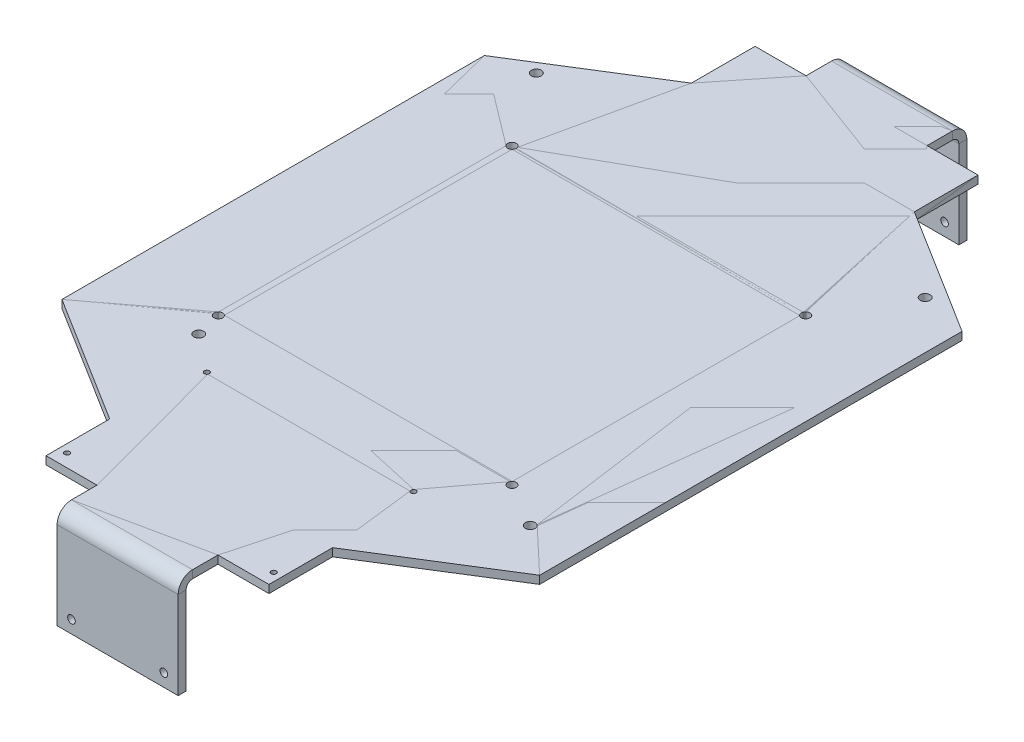
from build123d import *

# Parameters (mm, degrees)
BOSS_EXTRUDE1_DEPTH     = 3.175
CONVERT_SOLID1_DEPTH    = 3.175
EDGE_FLANGE3_DEPTH      = 48.26
EDGE_FLANGE3_BEND_DEPTH = 48.26
SKETCH23_R              = 1.9685000000000155
SKETCH23_R_2            = 1.968500000000002
CUT_EXTRUDE4_DEPTH      = 5.08
SKETCH24_R              = 1.0032999999999983
SKETCH24_R_2            = 1.0032999999999943
CUT_EXTRUDE5_DEPTH      = 188.63312250256496
SKETCH30_R              = 1.524000000000002
CUT_EXTRUDE6_DEPTH      = 3.175
SKETCH27_R              = 1.524000000000002
CUT_EXTRUDE7_DEPTH      = 3.175


# Read off the part's stored shape, not the designer's step: Convert-Solid1
# Sheet-metal steps are written as plain solids
with BuildPart() as part:
    # Sketch2 → Boss-Extrude1 (new body)
    with BuildSketch(Plane(origin=(0, 0, 0), x_dir=(1, 0, 0), z_dir=(0, 1, 0))):
        Polygon((44.45000000000084, 115.98275000000001), (95.25000000000001, 84.23274999999997), (95.25000000000001, -84.23274999999997), (44.45000000000084, -115.98275000000001), (44.450000000000905, -141.38275), (24.130000000000035, -141.38275), (24.13, -151.54274999999998), (-24.13, -151.54274999999998), (-24.129999999999963, -141.38275), (-44.450000000000834, -141.38275), (-44.45000000000083, -115.98275), (-95.24999999999996, -84.23275), (-95.24999999999996, 84.23275), (-44.45000000000083, 115.98275), (-44.450000000000905, 141.38275), (-24.130000000000035, 141.38275), (-24.13, 151.54274999999998), (24.13, 151.54274999999998), (24.130000000000035, 141.38275), (44.450000000000905, 141.38275), align=None)
    extrude(amount=BOSS_EXTRUDE1_DEPTH)


with BuildPart() as body_2:
    # Convert-Solid1 outline → Convert-Solid1 (new body)
    with BuildSketch(Plane(origin=(0, 0, 0), x_dir=(1, 0, 0), z_dir=(0, 1, 0))):
        Polygon((-24.13, -141.38275), (-24.13, -151.54275), (24.13, -151.54275), (24.13, -141.38275), (44.45, -141.38275), (44.45, -115.98275), (95.25, -84.23275), (95.25, 84.23275), (44.45, 115.98275), (44.45, 141.38275), (24.13, 141.38275), (24.13, 151.54275), (-24.13, 151.54275), (-24.13, 141.38275), (-44.45, 141.38275), (-44.45, 115.98275), (-95.25, 84.23275), (-95.25, -84.23275), (-44.45, -115.98275), (-44.45, -141.38275), align=None)
    extrude(amount=CONVERT_SOLID1_DEPTH)

    # Edge-Flange3 section (across the edge) → Edge-Flange3 (add)
    with BuildSketch(Plane(origin=(24.13, 1.774e-14, 154.08275), x_dir=(0, -3.49e-15, -1), z_dir=(-1, 0, 0))):
        with BuildLine():
            Line((-3.175, 2.540000000000009), (-3.175, 37.46500000000001))
            Line((-3.175, 37.46500000000001), (0, 37.46500000000001))
            Line((0, 37.46500000000001), (0, 2.540000000000009))
            ThreePointArc((0, 2.540000000000009), (0.7439487757861725, 0.7439487757861749), (2.540000000000009, 8.88e-15))
            Line((2.540000000000009, 8.88e-15), (2.54000000000002, -3.174999999999991))
            ThreePointArc((2.54000000000002, -3.174999999999991), (-1.5011152544811113, -1.5011152544811175), (-3.175, 2.540000000000009))
        make_face()
    extrude(amount=EDGE_FLANGE3_DEPTH)

    # Edge-Flange3 section 2 (across the edge) → Edge-Flange3 bend (add)
    with BuildSketch(Plane(origin=(-24.13, 1.774e-14, -154.08275), x_dir=(0, -3.49e-15, 1), z_dir=(1, 0, 0))):
        with BuildLine():
            Line((-3.175, 2.540000000000009), (-3.175, 37.46500000000001))
            Line((-3.175, 37.46500000000001), (0, 37.46500000000001))
            Line((0, 37.46500000000001), (0, 2.540000000000009))
            ThreePointArc((0, 2.540000000000009), (0.7439487757861725, 0.7439487757861749), (2.540000000000009, 8.88e-15))
            Line((2.540000000000009, 8.88e-15), (2.54000000000002, -3.174999999999991))
            ThreePointArc((2.54000000000002, -3.174999999999991), (-1.5011152544811113, -1.5011152544811175), (-3.175, 2.540000000000009))
        make_face()
    extrude(amount=EDGE_FLANGE3_BEND_DEPTH)


with BuildPart() as cut_extrude4_tool:
    # Sketch23 → Cut-Extrude4 (new, symmetric)
    with BuildSketch(Plane(origin=(0, 0, 0), x_dir=(-1, 0, 0), z_dir=(0, -1, 0))):
        with Locations(Location((78.84159999999999, 88.55075000000001, 0), (0, 0, 90))):
            Circle(SKETCH23_R)
        with Locations(Location((-76.20000000000002, 88.55075000000001, 0), (0, 0, 90))):
            Circle(SKETCH23_R_2)
        with BuildLine():
            Line((-58.55969999999999, 56.84519999999998), (-58.55969999999999, 58.55969999999998))
            Line((-58.55969999999999, 58.55969999999998), (-56.84519999999999, 58.55969999999998))
            ThreePointArc((-56.84519999999999, 58.55969999999998), (-59.772034576344325, 59.77203457634431), (-58.55969999999999, 56.84519999999998))
        make_face()
        with BuildLine():
            Line((-56.84519999999999, 58.55969999999998), (-58.55969999999999, 58.55969999999998))
            Line((-58.55969999999999, 58.55969999999998), (-58.55969999999999, 56.84519999999998))
            ThreePointArc((-58.55969999999999, 56.84519999999998), (-57.34736542365566, 57.34736542365564), (-56.84519999999999, 58.55969999999998))
        make_face()
        with BuildLine():
            ThreePointArc((60.27419999999999, 58.55969999999998), (58.55969999999999, 60.27419999999998), (56.84519999999999, 58.55969999999998))
            Line((56.84519999999999, 58.55969999999998), (58.55969999999999, 58.55969999999998))
            Line((58.55969999999999, 58.55969999999998), (58.55969999999999, 56.84519999999998))
            ThreePointArc((58.55969999999999, 56.84519999999998), (59.772034576344325, 57.34736542365564), (60.27419999999999, 58.55969999999998))
        make_face()
        with BuildLine():
            Line((58.55969999999999, 58.55969999999998), (56.84519999999999, 58.55969999999998))
            ThreePointArc((56.84519999999999, 58.55969999999998), (57.34736542365565, 57.347365423655646), (58.55969999999999, 56.84519999999998))
            Line((58.55969999999999, 56.84519999999998), (58.55969999999999, 58.55969999999998))
        make_face()
        with BuildLine():
            ThreePointArc((-56.84519999999998, -58.55970000000001), (-57.347365423655646, -57.347365423655674), (-58.55969999999998, -56.845200000000006))
            Line((-58.55969999999998, -56.845200000000006), (-58.55969999999998, -58.55970000000001))
            Line((-58.55969999999998, -58.55970000000001), (-56.84519999999998, -58.55970000000001))
        make_face()
        with BuildLine():
            Line((-58.55969999999998, -58.55970000000001), (-58.55969999999998, -56.845200000000006))
            ThreePointArc((-58.55969999999998, -56.845200000000006), (-59.77203457634432, -59.77203457634434), (-56.84519999999998, -58.55970000000001))
            Line((-56.84519999999998, -58.55970000000001), (-58.55969999999998, -58.55970000000001))
        make_face()
        with Locations(Location((-76.20000000000002, -68.92925, 0), (0, 0, 90))):
            Circle(SKETCH23_R_2)
        with BuildLine():
            ThreePointArc((60.27420000000001, -58.55970000000001), (59.77203457634434, -57.347365423655674), (58.55970000000001, -56.845200000000006))
            Line((58.55970000000001, -56.845200000000006), (58.55970000000001, -58.55970000000001))
            Line((58.55970000000001, -58.55970000000001), (56.845200000000006, -58.55970000000001))
            ThreePointArc((56.845200000000006, -58.55970000000001), (58.55970000000001, -60.27420000000001), (60.27420000000001, -58.55970000000001))
        make_face()
        with BuildLine():
            Line((58.55970000000001, -58.55970000000001), (58.55970000000001, -56.845200000000006))
            ThreePointArc((58.55970000000001, -56.845200000000006), (57.347365423655674, -57.347365423655674), (56.845200000000006, -58.55970000000001))
            Line((56.845200000000006, -58.55970000000001), (58.55970000000001, -58.55970000000001))
        make_face()
        with Locations(Location((56.00699999999998, -68.92925, 0), (0, 0, 90))):
            Circle(SKETCH23_R)
    extrude(amount=CUT_EXTRUDE4_DEPTH, both=True)


with BuildPart() as part_1:
    add(part.part)

    # Cut-Extrude4: cut by cut_extrude4_tool
    add(cut_extrude4_tool.part, mode=Mode.SUBTRACT)


with BuildPart() as body_2_1:
    add(body_2.part)

    # Cut-Extrude4: cut by cut_extrude4_tool
    add(cut_extrude4_tool.part, mode=Mode.SUBTRACT)


with BuildPart() as cut_extrude5_tool:
    # Sketch24 → Cut-Extrude5 (new, through all)
    with BuildSketch(Plane(origin=(0, 0, 0), x_dir=(-1, 0, 0), z_dir=(0, -1, 0))):
        with Locations(Location((41.211500000000015, -136.23924999999994, 0), (0, 0, 90))):
            Circle(SKETCH24_R)
        with Locations(Location((-41.21149999999999, -136.23924999999994, 0), (0, 0, 90))):
            Circle(SKETCH24_R)
        with Locations(Location((-41.21149999999999, -80.48624999999994, 0), (0, 0, 90))):
            Circle(SKETCH24_R_2)
        with Locations(Location((41.211500000000015, -80.48624999999996, 0), (0, 0, 90))):
            Circle(SKETCH24_R_2)
    extrude(amount=-CUT_EXTRUDE5_DEPTH)


with BuildPart() as part_2:
    add(part_1.part)

    # Cut-Extrude5: cut by cut_extrude5_tool
    add(cut_extrude5_tool.part, mode=Mode.SUBTRACT)


with BuildPart() as body_2_2:
    add(body_2_1.part)

    # Cut-Extrude5: cut by cut_extrude5_tool
    add(cut_extrude5_tool.part, mode=Mode.SUBTRACT)

    # Sketch30 → Cut-Extrude6 (cut)
    with BuildSketch(Plane(origin=(0, 5.8251e-13, -157.25775), x_dir=(-1, 0, 0), z_dir=(0, 3.7e-15, -1))):
        with Locations(Location((-18.414999999999996, -32.38500000000058, 0), (0, 0, 90))):
            Circle(SKETCH30_R)
        with Locations(Location((18.415, -32.38500000000057, 0), (0, 0, 90))):
            Circle(SKETCH30_R)
    extrude(amount=-CUT_EXTRUDE6_DEPTH, mode=Mode.SUBTRACT)

    # Sketch27 → Cut-Extrude7 (cut)
    with BuildSketch(Plane.XY.offset(157.25775)):
        with Locations(Location((-18.414999999999996, -32.38500000000057, 0), (0, 0, 90))):
            Circle(SKETCH27_R)
        with Locations(Location((18.415, -32.385000000000566, 0), (0, 0, 90))):
            Circle(SKETCH27_R)
    extrude(amount=-CUT_EXTRUDE7_DEPTH, mode=Mode.SUBTRACT)


solid = Compound([part_2.part, body_2_2.part])
